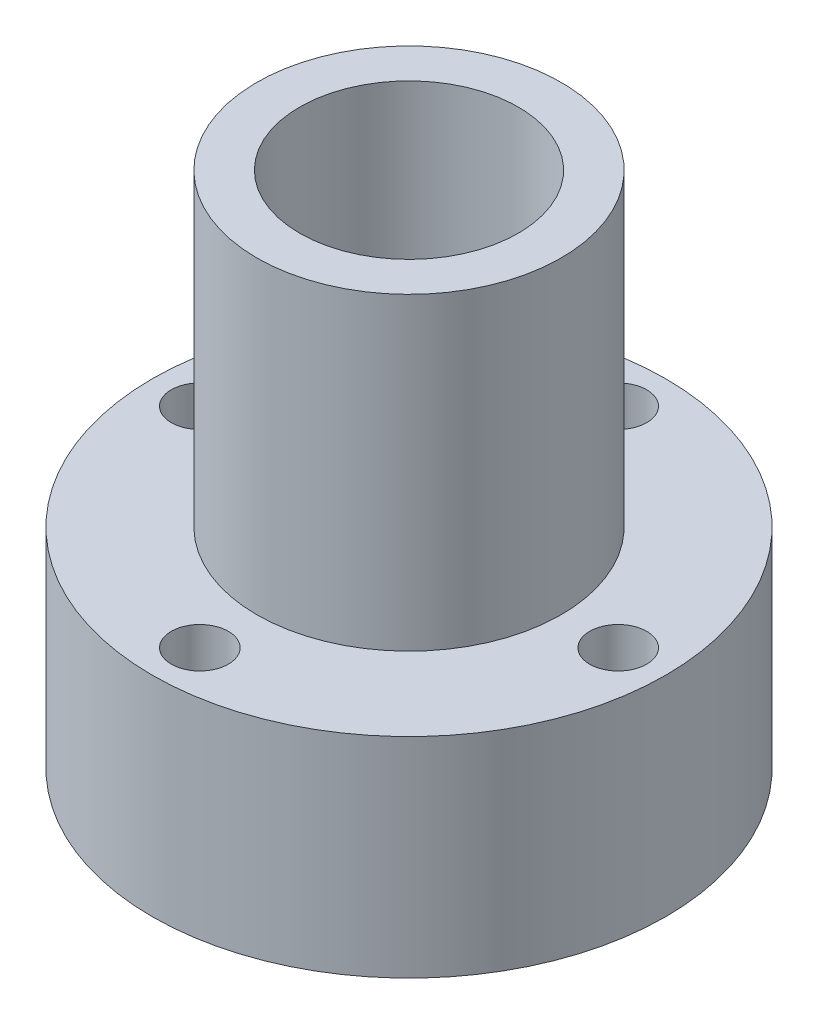
from build123d import *

# Parameters (mm, degrees)
SZKIC2_R                   = 3
WYTNIJ_WYCI_GNI_CIE1_DEPTH = 51.142297514


with BuildPart() as part:
    # Szkic1 → Obrót1 (revolve)
    with BuildSketch(Plane.XY):
        Polygon((-16, 23.5), (-16, 56), (-11.5, 56), (-11.5, 0), (-15, 0), (-15, 1.5), (-27, 1.5), (-27, 23.5), align=None)
    revolve(axis=Axis((0, 0, 0), (0, -1, 0)))

    # Szkic2 → Wytnij-wyciągnięcie1 (cut, through all)
    with BuildSketch(Plane(origin=(0, 23.5, 0), x_dir=(1, 0, 0), z_dir=(0, 1, 0))):
        with Locations((0, 22)):
            Circle(SZKIC2_R)
        with Locations((22, 0)):
            Circle(SZKIC2_R)
        with Locations((0, -22)):
            Circle(SZKIC2_R)
        with Locations((-22, 0)):
            Circle(SZKIC2_R)
    extrude(amount=-WYTNIJ_WYCI_GNI_CIE1_DEPTH, mode=Mode.SUBTRACT)


solid = part.part
